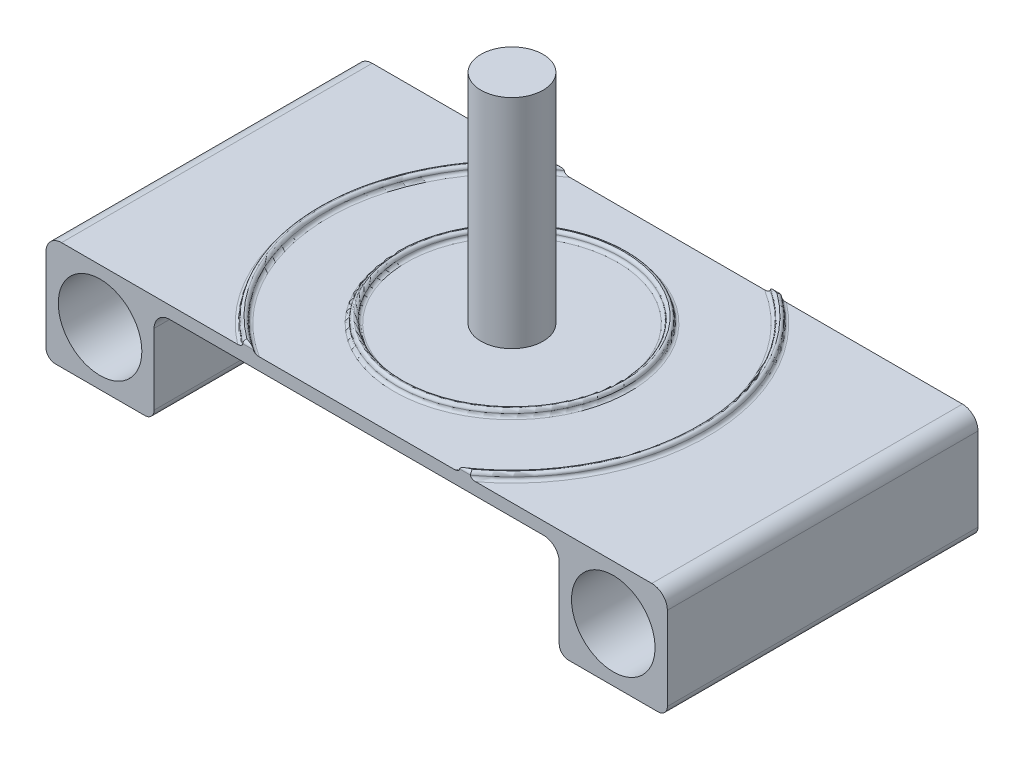
from build123d import *

# Parameters (mm, degrees)
SKETCH1_R           = 13.45
BOSS_EXTRUDE1_DEPTH = 100
SKETCH2_R           = 9.999999999999995
BOSS_EXTRUDE2_DEPTH = 70
SKETCH3_R           = 37.00000000000001
SKETCH3_R_2         = 35.00000000000001
BOSS_EXTRUDE3_DEPTH = 2
FILLET1_R           = 1
FILLET2_R           = 5
FILLET3_R           = 3


with BuildPart() as part:
    # Sketch1 → Boss-Extrude1 (new body)
    with BuildSketch(Plane.XY):
        Polygon((-17.400000000000034, 17.399999999999995), (17.399999999999963, 17.399999999999995), (82.59999999999998, 17.399999999999995), (82.59999999999998, 13.399999999999995), (17.399999999999963, 13.399999999999995), (17.399999999999977, -17.400000000000002), (-17.40000000000002, -17.400000000000002), align=None)
        Circle(SKETCH1_R, mode=Mode.SUBTRACT)
    boss_extrude1 = extrude(amount=-BOSS_EXTRUDE1_DEPTH)

    # Mirror1: Boss-Extrude1 across plane
    add(boss_extrude1.mirror(Plane(origin=(82.59999999999998, 17.399999999999995, -100), x_dir=(0, 0, 1), z_dir=(1, 0, 0))))

    # Sketch2 → Boss-Extrude2 (add)
    with BuildSketch(Plane(origin=(0, 17.399999999999995, 0), x_dir=(1, 0, 0), z_dir=(0, 1, 0))):
        with Locations(Location((82.59999999999998, 50, 0), (0, 0, 270))):
            Circle(SKETCH2_R)
    extrude(amount=BOSS_EXTRUDE2_DEPTH)

    # Sketch3 → Boss-Extrude3 (add)
    # profile 1 of 5: a face of its own
    with BuildSketch(Plane(origin=(0, 17.399999999999995, 0), x_dir=(1, 0, 0), z_dir=(0, 1, 0))):
        with BuildLine():
            ThreePointArc((115.76624790355208, 100.00000000000125), (135.46764073709514, 78.37274330926492), (142.59999999999997, 50))
            ThreePointArc((142.59999999999997, 49.999999999999986), (135.4676407370951, 21.62725669073505), (115.76624790355206, -1.26477e-12))
            Line((115.76624790355174, 0), (119.26060555964779, 0))
            ThreePointArc((119.26060555964757, 6.3949e-13), (137.90351500898538, 21.972848384987014), (144.59999999999997, 49.999999999999986))
            ThreePointArc((144.59999999999997, 50), (137.9035150089854, 78.02715161501295), (119.26060555964762, 99.99999999999932))
            Line((119.26060555964781, 100), (115.76624790355174, 100))
        make_face()
    # profile 2 of 5: a face of its own
    with BuildSketch(Plane(origin=(0, 17.399999999999995, 0), x_dir=(1, 0, 0), z_dir=(0, 1, 0))):
        with BuildLine():
            ThreePointArc((49.43375209644623, -1.7053e-13), (22.59999999999998, 50.00000000000001), (49.43375209644624, 100.00000000000017))
            Line((49.433752096446284, 100), (45.93939444035465, 100))
            ThreePointArc((45.9393944403544, 100.00000000000084), (20.59999999999998, 50.00000000000001), (45.93939444035441, -8.4555e-13))
            Line((45.939394440354675, 0), (49.433752096446284, 0))
        make_face()
    # profile 3 of 5: a face of its own
    with BuildSketch(Plane(origin=(0, 17.399999999999995, 0), x_dir=(1, 0, 0), z_dir=(0, 1, 0))):
        with Locations(Location((82.59999999999998, 50, 0), (0, 0, 270))):
            Circle(SKETCH3_R)
        with Locations(Location((82.59999999999998, 50, 0), (0, 0, 270))):
            Circle(SKETCH3_R_2, mode=Mode.SUBTRACT)
    # profile 4 of 5: a face of its own
    with BuildSketch(Plane(origin=(0, 17.399999999999995, 0), x_dir=(1, 0, 0), z_dir=(0, 1, 0))):
        with BuildLine():
            ThreePointArc((115.76624790355208, 100.00000000000125), (135.46764073709514, 78.37274330926492), (142.59999999999997, 50))
            ThreePointArc((142.59999999999997, 49.999999999999986), (135.4676407370951, 21.62725669073505), (115.76624790355206, -1.26477e-12))
            Line((115.76624790355174, 0), (119.26060555964779, 0))
            ThreePointArc((119.26060555964757, 6.3949e-13), (137.90351500898538, 21.972848384987014), (144.59999999999997, 49.999999999999986))
            ThreePointArc((144.59999999999997, 50), (137.9035150089854, 78.02715161501295), (119.26060555964762, 99.99999999999932))
            Line((119.26060555964781, 100), (115.76624790355174, 100))
        make_face()
    # profile 5 of 5: a face of its own
    with BuildSketch(Plane(origin=(0, 17.399999999999995, 0), x_dir=(1, 0, 0), z_dir=(0, 1, 0))):
        with BuildLine():
            ThreePointArc((49.43375209644623, -1.7053e-13), (22.59999999999998, 50.00000000000001), (49.43375209644624, 100.00000000000017))
            Line((49.433752096446284, 100), (45.93939444035465, 100))
            ThreePointArc((45.9393944403544, 100.00000000000084), (20.59999999999998, 50.00000000000001), (45.93939444035441, -8.4555e-13))
            Line((45.939394440354675, 0), (49.433752096446284, 0))
        make_face()
    extrude(amount=BOSS_EXTRUDE3_DEPTH)

    # Fillet1
    fillet1_edges = [part.edges().sort_by_distance(p)[0] for p in [
        (20.599999999999973, 17.399999999999995, -50),
        (22.59999999999998, 19.399999999999995, -50.00000000000001),
        (47.686573268400466, 19.399999999999995, -100),
        (20.599999999999973, 19.399999999999995, -50),
        (47.68657326840048, 19.399999999999995, 0),
        (22.59999999999998, 17.399999999999995, -50.00000000000001),
        (82.6, 17.399999999999995, -85),
        (82.6, 19.399999999999995, -85),
        (82.6, 17.399999999999995, -87),
        (82.6, 19.399999999999995, -87),
        (144.59999999999997, 17.399999999999995, -49.999999999999986),
        (142.59999999999997, 19.399999999999995, -50),
        (117.51342673159976, 19.399999999999995, 0),
        (144.59999999999997, 19.399999999999995, -49.999999999999986),
        (117.51342673159978, 19.399999999999995, -100),
        (142.59999999999997, 17.399999999999995, -50.00000000000001),
    ]]
    fillet(fillet1_edges, radius=FILLET1_R - 0.0001)  # a hair under: the kernel refuses the full size

    # Fillet2
    fillet2_edges = [part.edges().sort_by_distance(p)[0] for p in [
        (-17.400000000000034, 17.399999999999995, -50),
        (17.399999999999963, 13.399999999999995, -50),
        (147.8, 13.399999999999995, -50),
        (182.6, 17.399999999999995, -50),
    ]]
    fillet(fillet2_edges, radius=FILLET2_R)

    # Fillet3
    fillet3_edges = [part.edges().sort_by_distance(p)[0] for p in [
        (17.399999999999977, -17.400000000000002, -50),
        (-17.40000000000002, -17.400000000000002, -50),
        (147.79999999999998, -17.400000000000002, -50),
        (182.59999999999997, -17.400000000000002, -50),
    ]]
    fillet(fillet3_edges, radius=FILLET3_R)


solid = part.part
